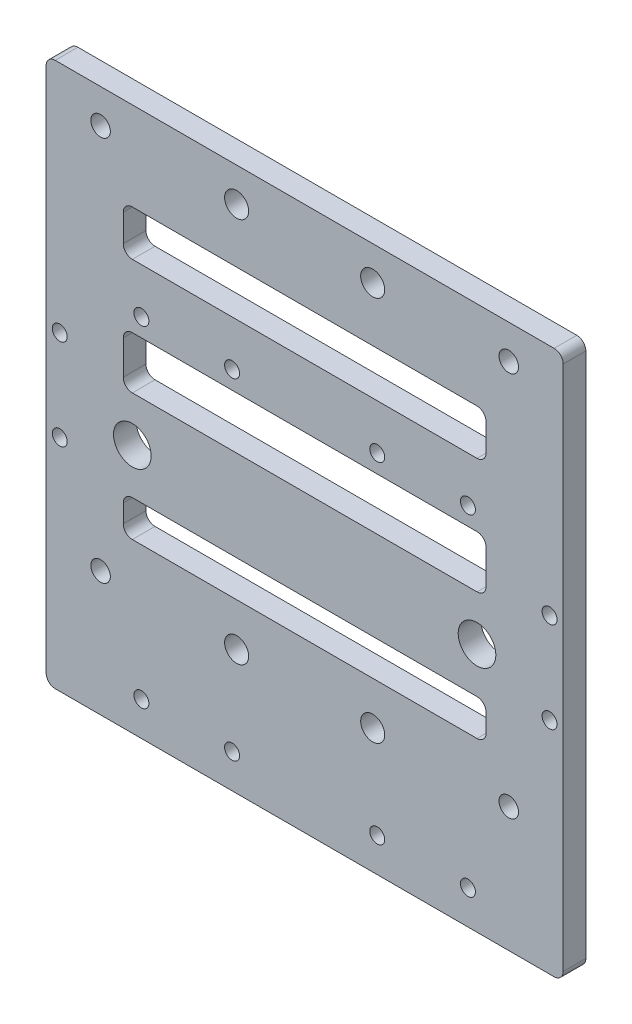
from build123d import *

# Parameters (mm, degrees)
SKETCH_1_W          = 114
SKETCH_1_H          = 120
SKETCH_1_R          = 2.65
SKETCH_1_R_2        = 2.15
EXTRUDE_1_DEPTH     = 5
SKETCH_2_R          = 1.65
CUT_EXTRUDE_1_DEPTH = 83.909589313
SKETCH_3_R          = 4.15
CUT_EXTRUDE_2_DEPTH = 83.909589313
SKETCH_6_R          = 1.65
CUT_EXTRUDE_4_DEPTH = 83.909589313
SKETCH_7_W          = 80
SKETCH_7_H          = 11.5
SKETCH_7_H_2        = 10
SKETCH_7_H_3        = 8
CUT_EXTRUDE_5_DEPTH = 83.909589313
FILLET_1_R          = 2


with BuildPart() as part:
    # 草图1 → 凸台-拉伸1 (new body)
    with BuildSketch(Plane.XY):
        Rectangle(SKETCH_1_W, SKETCH_1_H)
        with Locations((-15, -32.5)):
            Circle(SKETCH_1_R, mode=Mode.SUBTRACT)
        with Locations((15, -32.5)):
            Circle(SKETCH_1_R, mode=Mode.SUBTRACT)
        with Locations((-45, -32.5)):
            Circle(SKETCH_1_R_2, mode=Mode.SUBTRACT)
        with Locations((45, -32.5)):
            Circle(SKETCH_1_R_2, mode=Mode.SUBTRACT)
        with Locations((-45, 52.5)):
            Circle(SKETCH_1_R_2, mode=Mode.SUBTRACT)
        with Locations((-15, 52.5)):
            Circle(SKETCH_1_R, mode=Mode.SUBTRACT)
        with Locations((15, 52.5)):
            Circle(SKETCH_1_R, mode=Mode.SUBTRACT)
        with Locations((45, 52.5)):
            Circle(SKETCH_1_R_2, mode=Mode.SUBTRACT)
    extrude(amount=EXTRUDE_1_DEPTH)

    # 草图2 → 切除-拉伸1 (cut, through all)
    with BuildSketch(Plane.XY.offset(5)):
        with Locations((-16, -52.5)):
            Circle(SKETCH_2_R)
        with Locations((-36, -52.5)):
            Circle(SKETCH_2_R)
        with Locations((16, -52.5)):
            Circle(SKETCH_2_R)
        with Locations((36, -52.5)):
            Circle(SKETCH_2_R)
        with Locations((-16, 20.5)):
            Circle(SKETCH_2_R)
        with Locations((-36, 20.5)):
            Circle(SKETCH_2_R)
        with Locations((16, 20.5)):
            Circle(SKETCH_2_R)
        with Locations((36, 20.5)):
            Circle(SKETCH_2_R)
    extrude(amount=-CUT_EXTRUDE_1_DEPTH, mode=Mode.SUBTRACT)

    # 草图3 → 切除-拉伸2 (cut, through all)
    with BuildSketch(Plane.XY.offset(5)):
        with Locations((-38, -5)):
            Circle(SKETCH_3_R)
        with Locations((38, -5)):
            Circle(SKETCH_3_R)
    extrude(amount=-CUT_EXTRUDE_2_DEPTH, mode=Mode.SUBTRACT)

    # 草图6 → 切除-拉伸4 (cut, through all)
    with BuildSketch(Plane.XY.offset(5)):
        with Locations((54, -11.5)):
            Circle(SKETCH_6_R)
        with Locations((54, 8.5)):
            Circle(SKETCH_6_R)
        with Locations((-54, -11.5)):
            Circle(SKETCH_6_R)
        with Locations((-54, 8.5)):
            Circle(SKETCH_6_R)
    extrude(amount=-CUT_EXTRUDE_4_DEPTH, mode=Mode.SUBTRACT)

    # 草图7 → 切除-拉伸5 (cut, through all)
    with BuildSketch(Plane.XY.offset(5)):
        with Locations((0, 10.75)):
            Rectangle(SKETCH_7_W, SKETCH_7_H)
        with Locations((0, 35.5)):
            Rectangle(SKETCH_7_W, SKETCH_7_H_2)
        with Locations((0, -19)):
            Rectangle(SKETCH_7_W, SKETCH_7_H_3)
    extrude(amount=-CUT_EXTRUDE_5_DEPTH, mode=Mode.SUBTRACT)

    # 圆角1
    fillet_1_edges = [part.edges().sort_by_distance(p)[0] for p in [
        (40, 5, 2.5),
        (40, 16.5, 2.5),
        (-40, 16.5, 2.5),
        (-40, 5, 2.5),
        (40, -15, 2.5),
        (40, -23, 2.5),
        (-40, -23, 2.5),
        (-40, -15, 2.5),
        (40, 30.5, 2.5),
        (40, 40.5, 2.5),
        (-40, 40.5, 2.5),
        (-40, 30.5, 2.5),
        (57, -60, 2.5),
        (-57, -60, 2.5),
        (-57, 60, 2.5),
        (57, 60, 2.5),
    ]]
    fillet(fillet_1_edges, radius=FILLET_1_R)


solid = part.part
